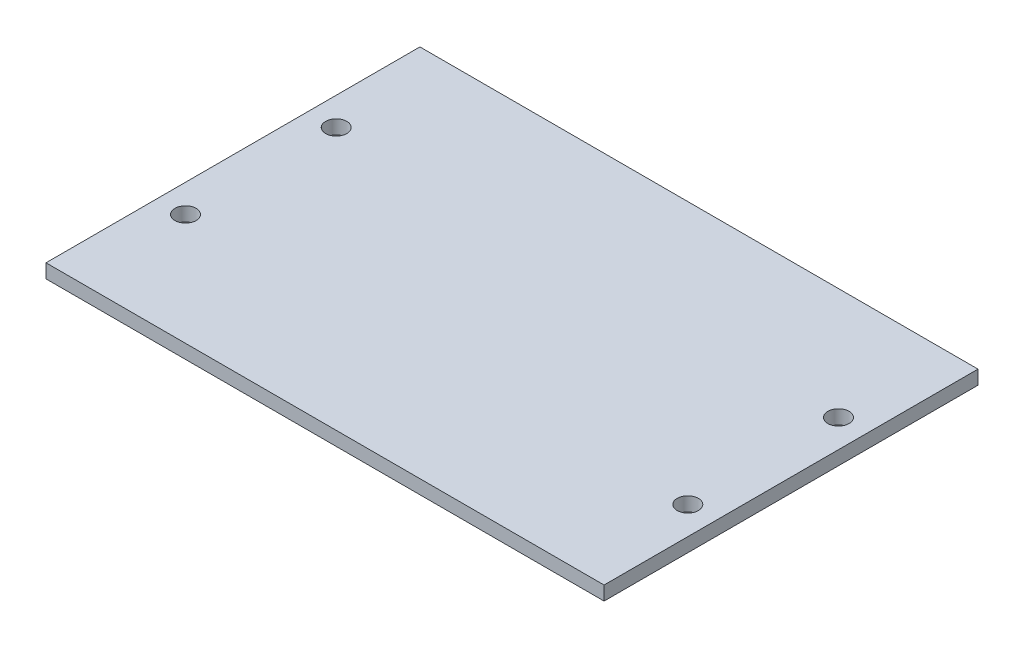
from build123d import *

# Parameters (mm, degrees)
SKETCH1_W           = 127
SKETCH1_H           = 85.09
BOSS_EXTRUDE1_DEPTH = 3.175
SKETCH2_R           = 2.413
CUT_EXTRUDE1_DEPTH  = 101.267182843


with BuildPart() as part:
    # Sketch1 → Boss-Extrude1 (new body)
    with BuildSketch(Plane(origin=(0, 0, 0), x_dir=(1, 0, 0), z_dir=(0, 1, 0))):
        with Locations((24.661627907, 5.109534884)):
            Rectangle(SKETCH1_W, SKETCH1_H)
    extrude(amount=BOSS_EXTRUDE1_DEPTH)

    # Sketch2 → Cut-Extrude1 (cut, through all)
    with BuildSketch(Plane(origin=(0, 3.175, 0), x_dir=(1, 0, 0), z_dir=(0, 1, 0))):
        with Locations((81.811627907, -12.035465116)):
            Circle(SKETCH2_R)
        with Locations((81.811627907, 22.254534884)):
            Circle(SKETCH2_R)
        with Locations((-32.488372093, 22.254534884)):
            Circle(SKETCH2_R)
        with Locations((-32.488372093, -12.035465116)):
            Circle(SKETCH2_R)
    extrude(amount=-CUT_EXTRUDE1_DEPTH, mode=Mode.SUBTRACT)


solid = part.part
